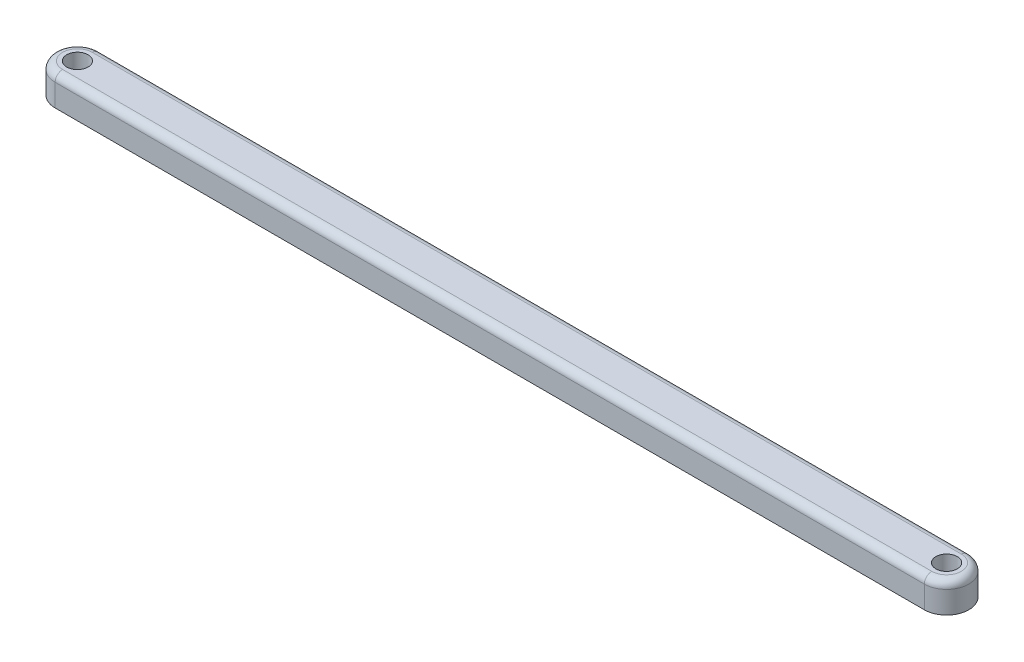
from build123d import *

# Parameters (mm, degrees)
BOSS_EXTRUDE1_DEPTH = 3.175
SKETCH2_R           = 2.286
CUT_EXTRUDE1_DEPTH  = 191.982518081
FILLET1_R           = 1.5875


with BuildPart() as part:
    # Sketch1 → Boss-Extrude1 (new, symmetric)
    with BuildSketch(Plane(origin=(0, 0, 0), x_dir=(1, 0, 0), z_dir=(0, 1, 0))):
        with BuildLine():
            Line((0, 4.7625), (186.055, 4.7625))
            ThreePointArc((186.055, 4.7625), (190.8175, 0), (186.055, -4.7625))
            Line((186.055, -4.7625), (0, -4.7625))
            ThreePointArc((0, -4.7625), (-4.7625, 0), (0, 4.7625))
        make_face()
    extrude(amount=BOSS_EXTRUDE1_DEPTH, both=True)

    # Sketch2 → Cut-Extrude1 (cut, through all)
    with BuildSketch(Plane(origin=(0, 3.175, 0), x_dir=(1, 0, 0), z_dir=(0, 1, 0))):
        Circle(SKETCH2_R)
        with Locations((186.055, 0)):
            Circle(SKETCH2_R)
    extrude(amount=-CUT_EXTRUDE1_DEPTH, mode=Mode.SUBTRACT)

    # Fillet1
    fillet1_edges = [part.edges().sort_by_distance(p)[0] for p in [
        (190.8175, 3.175, 0),
        (93.0275, 3.175, 4.7625),
        (-4.7625, 3.175, 0),
        (93.0275, 3.175, -4.7625),
    ]]
    fillet(fillet1_edges, radius=FILLET1_R)


solid = part.part
